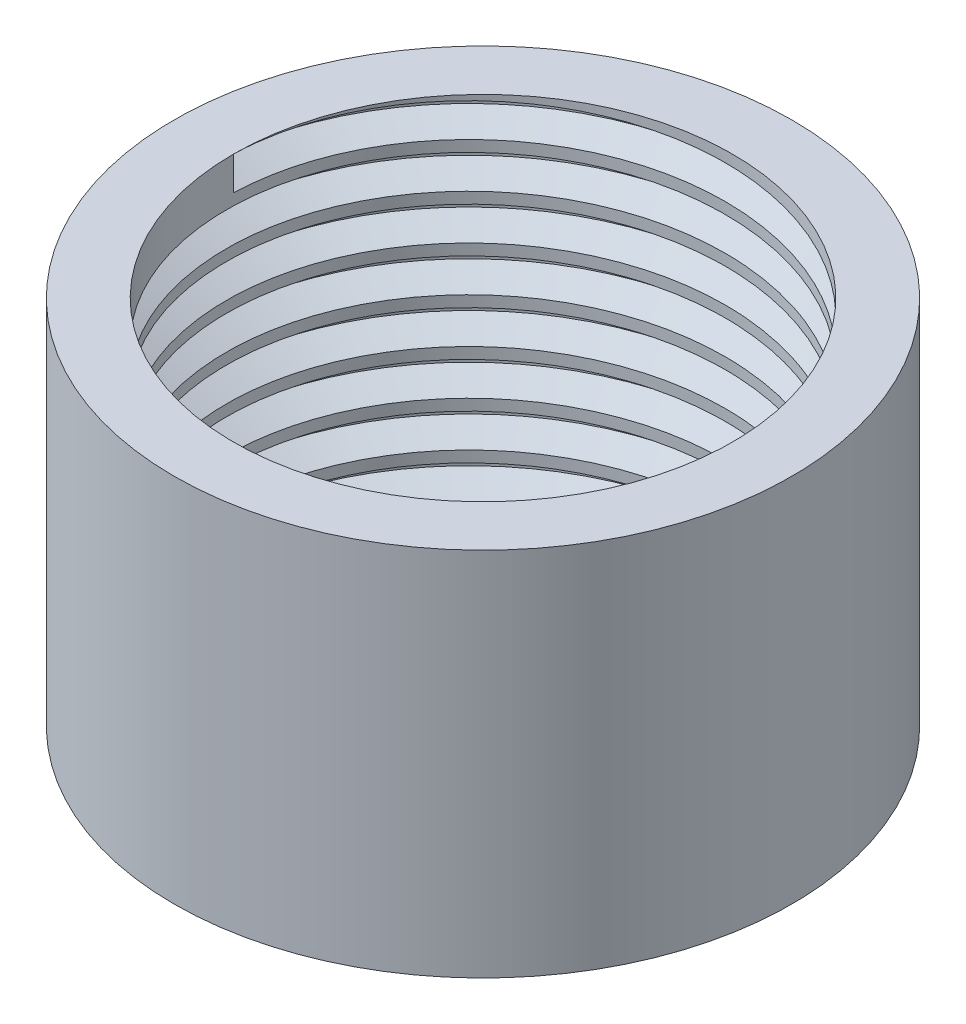
from build123d import *

# Parameters (mm, degrees)
SKETCH1_R           = 12.5
BOSS_EXTRUDE1_DEPTH = 15
SKETCH2_R           = 10.1
CUT_EXTRUDE1_DEPTH  = 24.184046239
THREAD1_PITCH       = 1.814285714


with BuildPart() as part:
    # Sketch1 → Boss-Extrude1 (new body)
    with BuildSketch(Plane(origin=(0, 0, 0), x_dir=(1, 0, 0), z_dir=(0, 1, 0))):
        with Locations(Location((0, 0, 0), (0, 0, 270))):
            Circle(SKETCH1_R)
    extrude(amount=BOSS_EXTRUDE1_DEPTH)

    # Sketch2 → Cut-Extrude1 (cut, through all)
    with BuildSketch(Plane(origin=(0, 15, 0), x_dir=(1, 0, 0), z_dir=(0, 1, 0))):
        with Locations(Location((0, 0, 0), (0, 0, 270))):
            Circle(SKETCH2_R)
    extrude(amount=-CUT_EXTRUDE1_DEPTH, mode=Mode.SUBTRACT)

    # Thread1: the profile of Thread Profile1 profile screwed along a right-hand helix of 8.267717 turns, 10 arcs to a turn; built about Z, then put on its axis
    thread1_z = Axis((0, 0, 0), (0, 0, 1))
    thread1_corners = [(10.0997, 0, -0.000173205), (11.082010945, 0, 0.566964283), (11.082010945, 0, 0.793749998), (10.0997, 0, 1.360887486)]
    with BuildLine(mode=Mode.PRIVATE) as thread1_profile:
        Line(thread1_corners[0], thread1_corners[1])
        Line(thread1_corners[1], thread1_corners[2])
        Line(thread1_corners[2], thread1_corners[3])
        Line(thread1_corners[3], thread1_corners[0])
    thread1_cap = Face(thread1_profile.wire())
    thread1_turn_angles = [0, 18, 36, 54, 72, 90, 108, 126, 144, 162, 180, 198, 216, 234, 252, 270, 288, 306, 324, 342, 360]
    thread1_turn_weights = [1, 0.9510565162951535, 1, 0.9510565162951535, 1, 0.9510565162951535, 1, 0.9510565162951535, 1, 0.9510565162951535, 1, 0.9510565162951535, 1, 0.9510565162951535, 1, 0.9510565162951535, 1, 0.9510565162951535, 1, 0.9510565162951535, 1]
    thread1_turn_rails = [Edge.make_bspline([Vector(p[0], p[1], 0).rotate(thread1_z, thread1_turn_angles[k]) / thread1_turn_weights[k] + Vector(0, 0, p[2] + THREAD1_PITCH * thread1_turn_angles[k] / 360) for k in range(21)], [0, 0, 0, 1, 1, 2, 2, 3, 3, 4, 4, 5, 5, 6, 6, 7, 7, 8, 8, 9, 9, 10, 10, 10], 2, thread1_turn_weights) for p in thread1_corners]
    thread1_turn_sides = [Face.make_surface_from_curves(thread1_turn_rails[p[0]], thread1_turn_rails[p[1]]) for p in [(0, 1), (1, 2), (2, 3), (3, 0)]]
    thread1_last_angles = [2880, 2898, 2916, 2934, 2952, 2964.188976378, 2976.377952756]
    thread1_last_weights = [1, 0.9510565162951535, 1, 0.9510565162951535, 1, 0.9774565347691503, 1]
    thread1_last_rails = [Edge.make_bspline([Vector(p[0], p[1], 0).rotate(thread1_z, thread1_last_angles[k]) / thread1_last_weights[k] + Vector(0, 0, p[2] + THREAD1_PITCH * thread1_last_angles[k] / 360) for k in range(7)], [0, 0, 0, 1, 1, 2, 2, 3, 3, 3], 2, thread1_last_weights) for p in thread1_corners]
    thread1_last_sides = [Face.make_surface_from_curves(thread1_last_rails[p[0]], thread1_last_rails[p[1]]) for p in [(0, 1), (1, 2), (2, 3), (3, 0)]]
    thread1 = Plane(origin=(0, 15, 0), x_dir=(-1, 0, 0), z_dir=(0, -1, 0)) * Solid(Shell([*[p.moved(Location((0, 0, THREAD1_PITCH * i))) for i in range(8) for p in thread1_turn_sides], *thread1_last_sides, thread1_cap, thread1_cap.rotate(thread1_z, 2976.377952756).moved(Location((0, 0, THREAD1_PITCH * 2976.377952756 / 360)))]))
    add(thread1, mode=Mode.SUBTRACT)


solid = part.part
